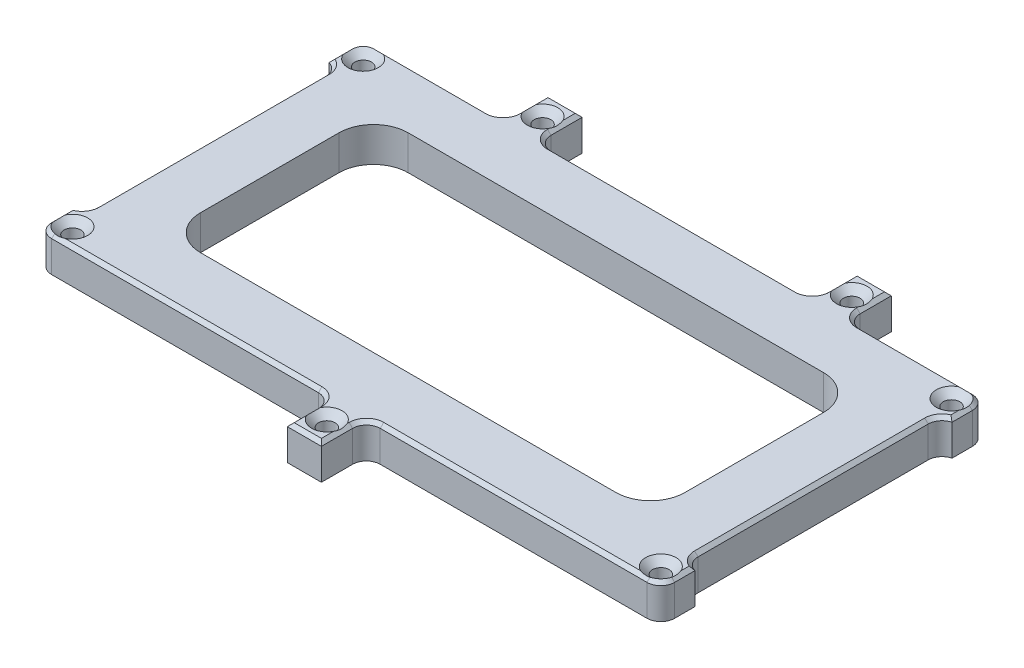
from build123d import *

# Parameters (mm, degrees)
BOSS_EXTRUDE1_DEPTH                                 = 5
CSK_FOR_M2_COUNTERSUNK_FLAT_HEAD_SCREW1_D           = 2.4
CSK_FOR_M2_COUNTERSUNK_FLAT_HEAD_SCREW1_CSINK_D     = 4.4
CSK_FOR_M2_COUNTERSUNK_FLAT_HEAD_SCREW1_CSINK_ANGLE = 90
FILLET2_R                                           = 2
CHAMFER2_SIZE                                       = 0.5
CUT_EXTRUDE1_REACH                                  = 56.314
SKETCH4_W                                           = 70
SKETCH4_H                                           = 30
FILLET3_R                                           = 5


with BuildPart() as part:
    # Sketch1 → Boss-Extrude1 (new body)
    with BuildSketch(Plane(origin=(0, 0, 0), x_dir=(1, 0, 0), z_dir=(0, 1, 0))):
        Polygon((-45, -23.5), (-45, -18.565), (-43.5, -18.565), (-43.5, 18.565), (-45, 18.565), (-45, 23.5), (-24.8, 23.5), (-24.8, 30), (-19.87, 30), (-19.87, 23.5), (19.87, 23.5), (19.87, 30), (24.8, 30), (24.8, 23.5), (45, 23.5), (45, 18.565), (43.5, 18.565), (43.5, -18.565), (45, -18.565), (45, -23.5), (2.465, -23.5), (2.465, -30), (-2.465, -30), (-2.465, -23.5), align=None)
    extrude(amount=BOSS_EXTRUDE1_DEPTH)

    # CSK for M2 Countersunk Flat Head Screw1 (through all)
    with Locations(Plane(origin=(0, 5, 0), x_dir=(1, 0, 0), z_dir=(0, 1, 0))):
        with Locations((0, -26.75), (22.335, 26.75), (-22.335, 26.75), (-42.5, 21), (-42.5, -21), (42.5, 21), (42.5, -21)):
            CounterSinkHole(CSK_FOR_M2_COUNTERSUNK_FLAT_HEAD_SCREW1_D / 2, CSK_FOR_M2_COUNTERSUNK_FLAT_HEAD_SCREW1_CSINK_D / 2, counter_sink_angle=CSK_FOR_M2_COUNTERSUNK_FLAT_HEAD_SCREW1_CSINK_ANGLE)

    # Fillet2
    # the kernel refuses this fillet: 2 mm, written as the material it adds along each edge
    with BuildSketch(Plane(origin=(-2.465, 0, 23.5), x_dir=(0, 0, 1), z_dir=(0, 1, 0))) as fillet2_piece_1:
        with BuildLine():
            CenterArc((FILLET2_R, -FILLET2_R), FILLET2_R, 90, 90)
            Line((0, -FILLET2_R), (0, 0))
            Line((0, 0), (FILLET2_R, 0))
        make_face()
    extrude(amount=5)
    with BuildSketch(Plane(origin=(-43.5, 0, 18.565), x_dir=(0, 0, -1), z_dir=(0, 1, 0)), Plane(origin=(43.5, 0, -18.565), x_dir=(0, 0, 1), z_dir=(0, 1, 0))) as fillet2_piece_2:
        with BuildLine():
            CenterArc((1.936491673, 2), FILLET2_R, 194.477512186, 75.522487814)
            Line((0, 1.5), (0, 0))
            Line((0, 0), (1.936491673, 0))
        make_face()
    extrude(amount=5)
    with BuildSketch(Plane(origin=(-43.5, 0, -18.565), x_dir=(-1, 0, 0), z_dir=(0, 1, 0)), Plane(origin=(43.5, 0, 18.565), x_dir=(1, 0, 0), z_dir=(0, 1, 0))) as fillet2_piece_3:
        with BuildLine():
            CenterArc((2, 1.936491673), FILLET2_R, 180, 75.522487814)
            Line((0, 1.936491673), (0, 0))
            Line((0, 0), (1.5, 0))
        make_face()
    extrude(amount=5)
    with BuildSketch(Plane(origin=(-24.8, 0, -23.5), x_dir=(0, 0, -1), z_dir=(0, 1, 0)), Plane(origin=(-19.87, 0, -23.5), x_dir=(1, 0, 0), z_dir=(0, 1, 0)), Plane(origin=(19.87, 0, -23.5), x_dir=(0, 0, -1), z_dir=(0, 1, 0)), Plane(origin=(24.8, 0, -23.5), x_dir=(1, 0, 0), z_dir=(0, 1, 0)), Plane(origin=(2.465, 0, 23.5), x_dir=(0, 0, 1), z_dir=(0, 1, 0))) as fillet2_piece_4:
        with BuildLine():
            CenterArc((FILLET2_R, FILLET2_R), FILLET2_R, 180, 90)
            Line((0, FILLET2_R), (0, 0))
            Line((0, 0), (FILLET2_R, 0))
        make_face()
    extrude(amount=5)
    # the kernel refuses this fillet: 2 mm, written as the material it takes off along each edge
    with BuildSketch(Plane(origin=(-45, -5, 23.5), x_dir=(0, 0, -1), z_dir=(0, 1, 0)), Plane(origin=(45, -5, -23.5), x_dir=(0, 0, 1), z_dir=(0, 1, 0)), Plane(origin=(45, -5, 23.5), x_dir=(-1, 0, 0), z_dir=(0, 1, 0))) as fillet2_2_piece_1:
        with BuildLine():
            CenterArc((FILLET2_R, -FILLET2_R), FILLET2_R, 90, 90)
            Line((0, -FILLET2_R), (0, 0))
            Line((0, 0), (FILLET2_R, 0))
        make_face()
    extrude(amount=15, mode=Mode.SUBTRACT)
    with BuildSketch(Plane(origin=(-45, -5, -23.5), x_dir=(0, 0, 1), z_dir=(0, 1, 0))) as fillet2_2_piece_2:
        with BuildLine():
            CenterArc((FILLET2_R, FILLET2_R), FILLET2_R, 180, 90)
            Line((0, FILLET2_R), (0, 0))
            Line((0, 0), (FILLET2_R, 0))
        make_face()
    extrude(amount=15, mode=Mode.SUBTRACT)

    # Chamfer2
    # the kernel refuses this chamfer: 0.5 mm, written as the material it takes off along each edge
    with BuildSketch(Plane(origin=(-2.465, 5, 31.285841494), x_dir=(1, 0, 0), z_dir=(0, 0, -1)), Plane(origin=(24.8, 5, -31.285841494), x_dir=(-1, 0, 0), z_dir=(0, 0, 1)), Plane(origin=(-19.87, 5, -31.285841494), x_dir=(-1, 0, 0), z_dir=(0, 0, 1)), Plane(origin=(19.87, 5, -25.5), x_dir=(1, 0, 0), z_dir=(0, 0, -1)), Plane(origin=(2.465, 5, 25.5), x_dir=(-1, 0, 0), z_dir=(0, 0, 1))) as chamfer2_piece_1:
        Polygon((CHAMFER2_SIZE, 0), (0, CHAMFER2_SIZE), (0, 0), align=None)
    extrude(amount=5.785841494, mode=Mode.SUBTRACT)
    with BuildSketch(Plane(origin=(-4.465, 5, 23.5), x_dir=(0, 0, -1), z_dir=(-1, 0, 0)), Plane(origin=(43, 5, 23.5), x_dir=(0, 0, -1), z_dir=(-1, 0, 0))) as chamfer2_piece_2:
        Polygon((CHAMFER2_SIZE, 0), (0, CHAMFER2_SIZE), (0, 0), align=None)
    extrude(amount=38.535, mode=Mode.SUBTRACT)
    with BuildSketch(Plane(origin=(18.584158506, 5, -30), x_dir=(0, 0, 1), z_dir=(1, 0, 0)), Plane(origin=(-26.085841494, 5, -30), x_dir=(0, 0, 1), z_dir=(1, 0, 0)), Plane(origin=(3.750841494, 5, 30), x_dir=(0, 0, -1), z_dir=(-1, 0, 0))) as chamfer2_piece_3:
        Polygon((CHAMFER2_SIZE, 0), (0, CHAMFER2_SIZE), (0, 0), align=None)
    extrude(amount=7.501682988, mode=Mode.SUBTRACT)
    with BuildSketch(Plane(origin=(26.8, 5, -23.5), x_dir=(0, 0, 1), z_dir=(1, 0, 0))) as chamfer2_piece_4:
        Polygon((CHAMFER2_SIZE, 0), (0, CHAMFER2_SIZE), (0, 0), align=None)
    extrude(amount=16.2, mode=Mode.SUBTRACT)
    with BuildSketch(Plane(origin=(-17.87, 5, -23.5), x_dir=(0, 0, 1), z_dir=(1, 0, 0))) as chamfer2_piece_5:
        Polygon((CHAMFER2_SIZE, 0), (0, CHAMFER2_SIZE), (0, 0), align=None)
    extrude(amount=35.74, mode=Mode.SUBTRACT)
    with BuildSketch(Plane(origin=(-43, 5, -23.5), x_dir=(0, -1, 0), z_dir=(1, 0, 0))) as chamfer2_piece_6:
        Polygon((CHAMFER2_SIZE, 0), (0, -CHAMFER2_SIZE), (0, 0), align=None)
    extrude(amount=16.2, mode=Mode.SUBTRACT)
    with BuildSketch(Plane(origin=(-45, 5, -17.279158506), x_dir=(1, 0, 0), z_dir=(0, 0, -1)), Plane(origin=(45, 5, 17.279158506), x_dir=(-1, 0, 0), z_dir=(0, 0, 1)), Plane(origin=(45, 5, -21.5), x_dir=(-1, 0, 0), z_dir=(0, 0, 1)), Plane(origin=(-45, 5, 21.5), x_dir=(1, 0, 0), z_dir=(0, 0, -1))) as chamfer2_piece_7:
        Polygon((CHAMFER2_SIZE, 0), (0, CHAMFER2_SIZE), (0, 0), align=None)
    extrude(amount=4.220841494, mode=Mode.SUBTRACT)
    with BuildSketch(Plane(origin=(-43.5, 5, 16.628508327), x_dir=(1, 0, 0), z_dir=(0, 0, -1)), Plane(origin=(43.5, 5, -16.628508327), x_dir=(-1, 0, 0), z_dir=(0, 0, 1))) as chamfer2_piece_8:
        Polygon((CHAMFER2_SIZE, 0), (0, CHAMFER2_SIZE), (0, 0), align=None)
    extrude(amount=33.257016654, mode=Mode.SUBTRACT)
    with BuildSketch(Plane(origin=(43, 5, 21.5), x_dir=(1, 0, 0), z_dir=(0, 0, -1))) as chamfer2_piece_9:
        Polygon((2 - CHAMFER2_SIZE, 0), (2, CHAMFER2_SIZE), (2, 0), align=None)
    revolve(axis=Axis((43, 5, 21.5), (0, -1, 0)), revolution_arc=90, mode=Mode.SUBTRACT)
    with BuildSketch(Plane(origin=(43, 5, -21.5), x_dir=(0, 0, -1), z_dir=(-1, 0, 0))) as chamfer2_piece_10:
        Polygon((2 - CHAMFER2_SIZE, 0), (2, CHAMFER2_SIZE), (2, 0), align=None)
    revolve(axis=Axis((43, 5, -21.5), (0, -1, 0)), revolution_arc=90, mode=Mode.SUBTRACT)
    with BuildSketch(Plane(origin=(-43, 5, -21.5), x_dir=(-1, 0, 0), z_dir=(0, 0, 1))) as chamfer2_piece_11:
        Polygon((2 - CHAMFER2_SIZE, 0), (2, CHAMFER2_SIZE), (2, 0), align=None)
    revolve(axis=Axis((-43, 5, -21.5), (0, -1, 0)), revolution_arc=90, mode=Mode.SUBTRACT)
    with BuildSketch(Plane(origin=(-43, 5, 21.5), x_dir=(0, 0, 1), z_dir=(1, 0, 0))) as chamfer2_piece_12:
        Polygon((2 - CHAMFER2_SIZE, 0), (2, CHAMFER2_SIZE), (2, 0), align=None)
    revolve(axis=Axis((-43, 5, 21.5), (0, -1, 0)), revolution_arc=90, mode=Mode.SUBTRACT)
    with BuildSketch(Plane(origin=(-4.465, 5, 25.5), x_dir=(1, 0, 0), z_dir=(0, 0, 1))) as chamfer2_piece_13:
        Polygon((2 + CHAMFER2_SIZE, 0), (2, -CHAMFER2_SIZE), (2, 0), align=None)
    revolve(axis=Axis((-4.465, 5, 25.5), (0, 1, 0)), revolution_arc=90, mode=Mode.SUBTRACT)
    with BuildSketch(Plane(origin=(-45.5, 5, 16.628508327), x_dir=(-0.38057900366880315, 0, 0.92474841009134), z_dir=(-0.92474841009134, 0, -0.38057900366880315))) as chamfer2_piece_14:
        Polygon((2 + CHAMFER2_SIZE, 0), (2, -CHAMFER2_SIZE), (2, 0), align=None)
    revolve(axis=Axis((-45.5, 5, 16.628508327), (0, 1, 0)), revolution_arc=112.369552085, mode=Mode.SUBTRACT)
    with BuildSketch(Plane(origin=(-45.5, 5, -16.628508327), x_dir=(1, 0, 0), z_dir=(0, 0, 1))) as chamfer2_piece_15:
        Polygon((2 + CHAMFER2_SIZE, 0), (2, -CHAMFER2_SIZE), (2, 0), align=None)
    revolve(axis=Axis((-45.5, 5, -16.628508327), (0, 1, 0)), revolution_arc=112.369552085, mode=Mode.SUBTRACT)
    with BuildSketch(Plane(origin=(-26.8, 5, -25.5), x_dir=(0, 0, 1), z_dir=(-1, 0, 0))) as chamfer2_piece_16:
        Polygon((2, -CHAMFER2_SIZE), (2 + CHAMFER2_SIZE, 0), (2, 0), align=None)
    revolve(axis=Axis((-26.8, 5, -25.5), (0, 1, 0)), revolution_arc=90, mode=Mode.SUBTRACT)
    with BuildSketch(Plane(origin=(-17.87, 5, -25.5), x_dir=(-1, 0, 0), z_dir=(0, 0, -1))) as chamfer2_piece_17:
        Polygon((2 + CHAMFER2_SIZE, 0), (2, -CHAMFER2_SIZE), (2, 0), align=None)
    revolve(axis=Axis((-17.87, 5, -25.5), (0, 1, 0)), revolution_arc=90, mode=Mode.SUBTRACT)
    with BuildSketch(Plane(origin=(17.87, 5, -25.5), x_dir=(0, 0, 1), z_dir=(-1, 0, 0))) as chamfer2_piece_18:
        Polygon((2 + CHAMFER2_SIZE, 0), (2, -CHAMFER2_SIZE), (2, 0), align=None)
    revolve(axis=Axis((17.87, 5, -25.5), (0, 1, 0)), revolution_arc=90, mode=Mode.SUBTRACT)
    with BuildSketch(Plane(origin=(26.8, 5, -25.5), x_dir=(-1, 0, 0), z_dir=(0, 0, -1))) as chamfer2_piece_19:
        Polygon((2 + CHAMFER2_SIZE, 0), (2, -CHAMFER2_SIZE), (2, 0), align=None)
    revolve(axis=Axis((26.8, 5, -25.5), (0, 1, 0)), revolution_arc=90, mode=Mode.SUBTRACT)
    with BuildSketch(Plane(origin=(45.5, 5, -16.628508327), x_dir=(0.38057900366879954, 0, -0.9247484100913416), z_dir=(0.9247484100913416, 0, 0.38057900366879954))) as chamfer2_piece_20:
        Polygon((2 + CHAMFER2_SIZE, 0), (2, -CHAMFER2_SIZE), (2, 0), align=None)
    revolve(axis=Axis((45.5, 5, -16.628508327), (0, 1, 0)), revolution_arc=112.369552085, mode=Mode.SUBTRACT)
    with BuildSketch(Plane(origin=(45.5, 5, 16.628508327), x_dir=(-1, 0, 0), z_dir=(0, 0, -1))) as chamfer2_piece_21:
        Polygon((2 + CHAMFER2_SIZE, 0), (2, -CHAMFER2_SIZE), (2, 0), align=None)
    revolve(axis=Axis((45.5, 5, 16.628508327), (0, 1, 0)), revolution_arc=112.369552085, mode=Mode.SUBTRACT)
    with BuildSketch(Plane(origin=(4.465, 5, 25.5), x_dir=(0, 0, -1), z_dir=(1, 0, 0))) as chamfer2_piece_22:
        Polygon((2 + CHAMFER2_SIZE, 0), (2, -CHAMFER2_SIZE), (2, 0), align=None)
    revolve(axis=Axis((4.465, 5, 25.5), (0, 1, 0)), revolution_arc=90, mode=Mode.SUBTRACT)
    with BuildSketch(Plane(origin=(-24.8, 5, -25.5), x_dir=(0, -1, 0), z_dir=(0, 0, -1))) as chamfer2_piece_23:
        Polygon((CHAMFER2_SIZE, 0), (0, -CHAMFER2_SIZE), (0, 0), align=None)
    extrude(amount=5.785841494, mode=Mode.SUBTRACT)

    # Sketch4 → Cut-Extrude1 (cut, up to next)
    with BuildSketch(Plane(origin=(0, 5, 0), x_dir=(1, 0, 0), z_dir=(0, 1, 0)), mode=Mode.PRIVATE) as cut_extrude1_sk1:
        Rectangle(SKETCH4_W, SKETCH4_H)
    cut_extrude1_tool1 = extrude(cut_extrude1_sk1.sketch, amount=-CUT_EXTRUDE1_REACH, mode=Mode.PRIVATE) & part.part
    add(cut_extrude1_tool1.solids().sort_by_distance((0, 5, 0))[0], mode=Mode.SUBTRACT)

    # Fillet3
    fillet3_edges = [part.edges().sort_by_distance(p)[0] for p in [
        (35, 2.5, -15),
        (35, 2.5, 15),
        (-35, 2.5, 15),
        (-35, 2.5, -15),
    ]]
    fillet(fillet3_edges, radius=FILLET3_R)


solid = part.part
